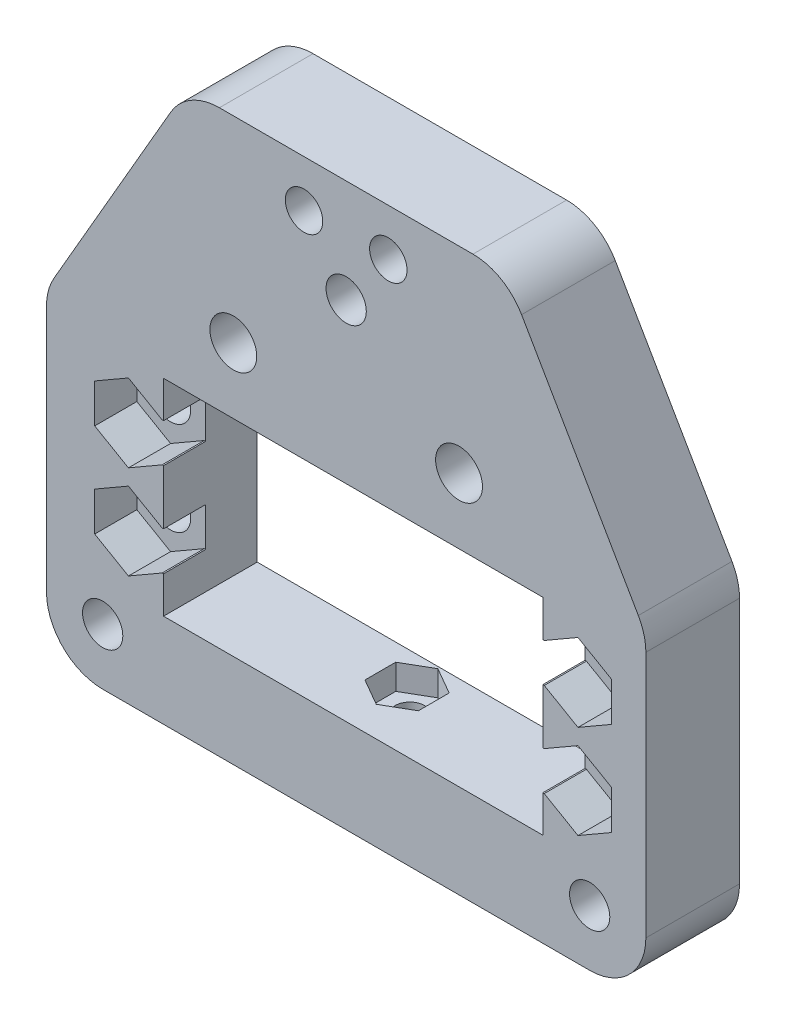
from build123d import *

# Parameters (mm, degrees)
EXTRUDE_1_DEPTH       = 10
FILLET_1_R            = 6
SKETCH_2_W            = 40.5
SKETCH_2_H            = 22
CUT_EXTRUDE_1_DEPTH   = 89.294960219
HOLE_WIZARD_4_0_1_D   = 4
HOLE_WIZARD_5_0_1_D   = 5
HOLE_WIZARD_M41_D     = 4.3
CUT_EXTRUDE_4_DEPTH   = 4.5
CUT_EXTRUDE_6_DEPTH   = 2.7
HOLE_WIZARD_M32_D     = 3.15
HOLE_WIZARD_M32_DEPTH = 10
HOLE_WIZARD_M32_TIP   = 0.946355475
HOLE_WIZARD_M42_D     = 4.3
CUT_EXTRUDE_7_DEPTH   = 3.2
SKETCH_19_W           = 4.5
SKETCH_19_H           = 4.156921938
CUT_EXTRUDE_13_DEPTH  = 0.15
SKETCH_21_W           = 4.5
SKETCH_21_H           = 4.156921938
CUT_EXTRUDE_14_DEPTH  = 0.15
SKETCH_22_W           = 4.5
SKETCH_22_H           = 4.156921938
CUT_EXTRUDE_15_DEPTH  = 0.15
SKETCH_23_W           = 4.5
SKETCH_23_H           = 4.156921938
CUT_EXTRUDE_16_DEPTH  = 0.15


with BuildPart() as part:
    # Эскиз1 → Бобышка-Вытянуть1 (new body)
    with BuildSketch(Plane.XY):
        Polygon((0, 0), (64, 0), (64, 34.019237886), (49, 60), (15, 60), (0, 34.02), align=None)
    extrude(amount=EXTRUDE_1_DEPTH)

    # Скругление1
    fillet_1_edges = [part.edges().sort_by_distance(p)[0] for p in [
        (49, 60, 5),
        (15, 60, 5),
        (0, 34.02, 5),
        (0, 0, 5),
        (64, 34.019237886, 5),
        (64, 0, 5),
    ]]
    fillet(fillet_1_edges, radius=FILLET_1_R)

    # Эскиз2 → Вырез-Вытянуть1 (cut, through all)
    with BuildSketch(Plane.XY.offset(10)):
        with Locations((32.75, 21)):
            Rectangle(SKETCH_2_W, SKETCH_2_H)
    extrude(amount=-CUT_EXTRUDE_1_DEPTH, mode=Mode.SUBTRACT)

    # Отверстия под штифты Ø4.0 мм1 (through all)
    with Locations(Plane.XY.offset(10)):
        with Locations((27.499949191, 55), (36.5, 55)):
            Hole(HOLE_WIZARD_4_0_1_D / 2)

    # Отверстия под штифты Ø5.0 мм1 (through all)
    with Locations(Plane.XY.offset(10)):
        with Locations((19.949949191, 39), (44.05, 39)):
            Hole(HOLE_WIZARD_5_0_1_D / 2)

    # Сверло под метчик  спиральное M41 (through all)
    with Locations(Plane.XY.offset(10)):
        with Locations((56.75, 26), (56.75, 16), (8.75, 26), (8.75, 16)):
            Hole(HOLE_WIZARD_M41_D / 2)

    # Эскиз9 → Вырез-Вытянуть4 (cut)
    with BuildSketch(Plane(origin=(0, 0, 10), x_dir=(-1, 0, 0), z_dir=(0, 0, -1))):
        Polygon((-56.75, 30.156921938), (-60.35, 28.078460969), (-60.35, 23.921539031), (-56.75, 21.843078062), (-53.15, 23.921539031), (-53.15, 28.078460969), align=None)
        Polygon((-56.75, 20.156921938), (-60.35, 18.078460969), (-60.35, 13.921539031), (-56.75, 11.843078062), (-53.15, 13.921539031), (-53.15, 18.078460969), align=None)
        Polygon((-8.75, 30.156921938), (-12.35, 28.078460969), (-12.35, 23.921539031), (-8.75, 21.843078062), (-5.15, 23.921539031), (-5.15, 28.078460969), align=None)
        Polygon((-8.75, 20.156921938), (-12.35, 18.078460969), (-12.35, 13.921539031), (-8.75, 11.843078062), (-5.15, 13.921539031), (-5.15, 18.078460969), align=None)
    extrude(amount=CUT_EXTRUDE_4_DEPTH, mode=Mode.SUBTRACT)

    # Эскиз12 → Вырез-Вытянуть6 (cut)
    with BuildSketch(Plane(origin=(0, 10, 0), x_dir=(1, 0, 0), z_dir=(0, 1, 0))):
        Polygon((31.999974596, -0.209103466), (29.149974596, -1.854551733), (29.149974596, -5.145448267), (31.999974596, -6.790896534), (34.849974596, -5.145448267), (34.849974596, -1.854551733), align=None)
    extrude(amount=-CUT_EXTRUDE_6_DEPTH, mode=Mode.SUBTRACT)

    # Сверло под метчик  спиральное M32
    with Locations(Plane(origin=(0, 0, 0), x_dir=(-1, 0, 0), z_dir=(0, -1, 0))):
        with Locations((-32, -3.2)):
            Hole(HOLE_WIZARD_M32_D / 2, depth=HOLE_WIZARD_M32_DEPTH)
            with Locations((0, 0, -(HOLE_WIZARD_M32_DEPTH + HOLE_WIZARD_M32_TIP / 2))):  # 118° drill point
                Cone(0, HOLE_WIZARD_M32_D / 2, HOLE_WIZARD_M32_TIP, mode=Mode.SUBTRACT)

    # Сверло под метчик  спиральное M42 (through all)
    with Locations(Plane.XY.offset(10)):
        with Locations((32, 49), (6, 6), (58, 6)):
            Hole(HOLE_WIZARD_M42_D / 2)

    # Эскиз18 → Вырез-Вытянуть7 (cut)
    with BuildSketch(Plane(origin=(0, 0, 0), x_dir=(-1, 0, 0), z_dir=(0, 0, -1))):
        Polygon((-32, 53.156921938), (-35.6, 51.078460969), (-35.6, 46.921539031), (-32, 44.843078062), (-28.4, 46.921539031), (-28.4, 51.078460969), align=None)
        Polygon((-58, 10.156921938), (-61.6, 8.078460969), (-61.6, 3.921539031), (-58, 1.843078062), (-54.4, 3.921539031), (-54.4, 8.078460969), align=None)
        Polygon((-6, 10.156921938), (-9.6, 8.078460969), (-9.6, 3.921539031), (-6, 1.843078062), (-2.4, 3.921539031), (-2.4, 8.078460969), align=None)
    extrude(amount=-CUT_EXTRUDE_7_DEPTH, mode=Mode.SUBTRACT)

    # Эскиз19 → Вырез-Вытянуть13 (cut)
    with BuildSketch(Plane.ZY.offset(-53)):
        with Locations((7.75, 26)):
            Rectangle(SKETCH_19_W, SKETCH_19_H)
    extrude(amount=-CUT_EXTRUDE_13_DEPTH, mode=Mode.SUBTRACT)

    # Эскиз21 → Вырез-Вытянуть14 (cut)
    with BuildSketch(Plane(origin=(12.5, 0, 0), x_dir=(0, 0, -1), z_dir=(1, 0, 0))):
        with Locations((-7.75, 26)):
            Rectangle(SKETCH_21_W, SKETCH_21_H)
    extrude(amount=-CUT_EXTRUDE_14_DEPTH, mode=Mode.SUBTRACT)

    # Эскиз22 → Вырез-Вытянуть15 (cut)
    with BuildSketch(Plane.ZY.offset(-53)):
        with Locations((7.75, 16)):
            Rectangle(SKETCH_22_W, SKETCH_22_H)
    extrude(amount=-CUT_EXTRUDE_15_DEPTH, mode=Mode.SUBTRACT)

    # Эскиз23 → Вырез-Вытянуть16 (cut)
    with BuildSketch(Plane(origin=(12.5, 0, 0), x_dir=(0, 0, -1), z_dir=(1, 0, 0))):
        with Locations((-7.75, 16)):
            Rectangle(SKETCH_23_W, SKETCH_23_H)
    extrude(amount=-CUT_EXTRUDE_16_DEPTH, mode=Mode.SUBTRACT)


solid = part.part
